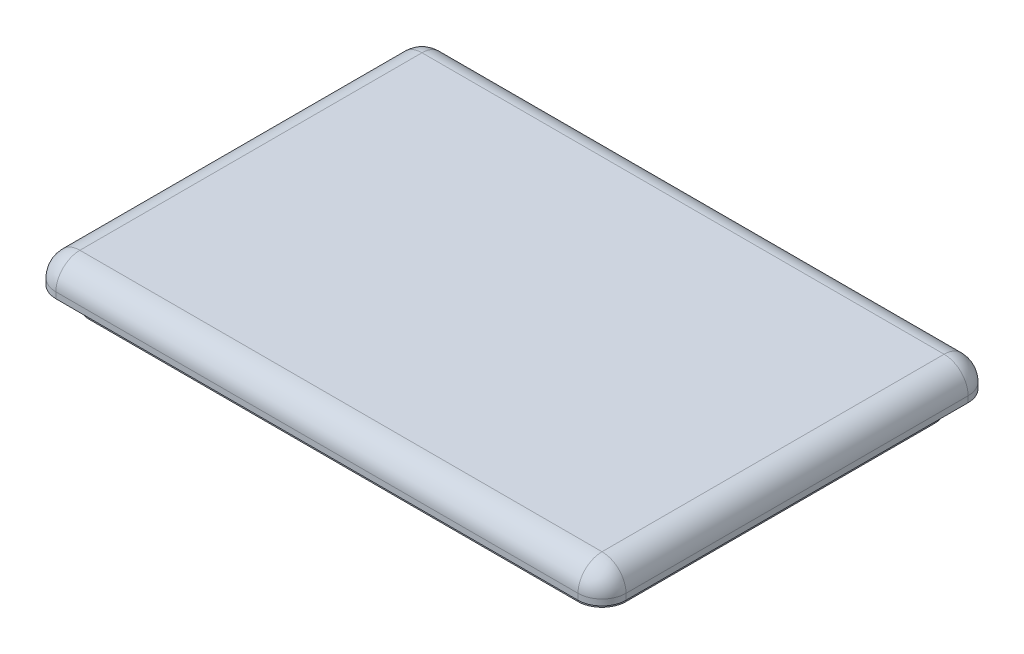
from build123d import *

# Parameters (mm, degrees)
SKETCH1_W           = 95
SKETCH1_H           = 65
BOSS_EXTRUDE1_DEPTH = 5
FILLET2_R           = 4
SKETCH3_W           = 89.4
SKETCH3_H           = 59.4
BOSS_EXTRUDE3_DEPTH = 3
FILLET3_R           = 4
SHELL1_START        = -3
SHELL1_DEPTH        = 5.5


# Read off the part's stored shape, not the designer's step: Shell1
with BuildPart() as part:
    # Sketch1 → Boss-Extrude1 (new body)
    with BuildSketch(Plane(origin=(0, 0, 0), x_dir=(1, 0, 0), z_dir=(0, 1, 0))):
        with Locations((47.5, 32.5)):
            Rectangle(SKETCH1_W, SKETCH1_H)
    extrude(amount=BOSS_EXTRUDE1_DEPTH)

    # Fillet2
    fillet2_edges = [part.edges().sort_by_distance(p)[0] for p in [
        (95, 5, -32.5),
        (47.5, 5, -65),
        (0, 5, -32.5),
        (0, 2.5, -65),
        (95, 2.5, -65),
        (95, 2.5, 0),
        (0, 2.5, 0),
        (47.5, 5, 0),
    ]]
    fillet(fillet2_edges, radius=FILLET2_R)

    # Sketch3 → Boss-Extrude3 (add)
    with BuildSketch(Plane.XZ):
        with Locations((47.5, -32.5)):
            Rectangle(SKETCH3_W, SKETCH3_H)
    extrude(amount=BOSS_EXTRUDE3_DEPTH)

    # Fillet3
    fillet3_edges = [part.edges().sort_by_distance(p)[0] for p in [
        (2.8, -1.5, -2.8),
        (2.8, -1.5, -62.2),
        (92.2, -1.5, -62.2),
        (92.2, -1.5, -2.8),
    ]]
    fillet(fillet3_edges, radius=FILLET3_R)

    # Shell1 outline → Shell1 (cut)
    with BuildSketch(Plane(origin=(0, 0, 0), x_dir=(1, 0, 0), z_dir=(0, 1, 0)).offset(SHELL1_START)):
        with BuildLine():
            Line((5.3, 58.2), (5.3, 6.8))
            ThreePointArc((5.3, 6.8), (5.739339828, 5.739339828), (6.8, 5.3))
            Line((6.8, 5.3), (88.2, 5.3))
            ThreePointArc((88.2, 5.3), (89.260660172, 5.739339828), (89.7, 6.8))
            Line((89.7, 6.8), (89.7, 58.2))
            ThreePointArc((89.7, 58.2), (89.260660172, 59.260660172), (88.2, 59.7))
            Line((88.2, 59.7), (6.8, 59.7))
            ThreePointArc((6.8, 59.7), (5.739339828, 59.260660172), (5.3, 58.2))
        make_face()
    extrude(amount=SHELL1_DEPTH, mode=Mode.SUBTRACT)


solid = part.part
